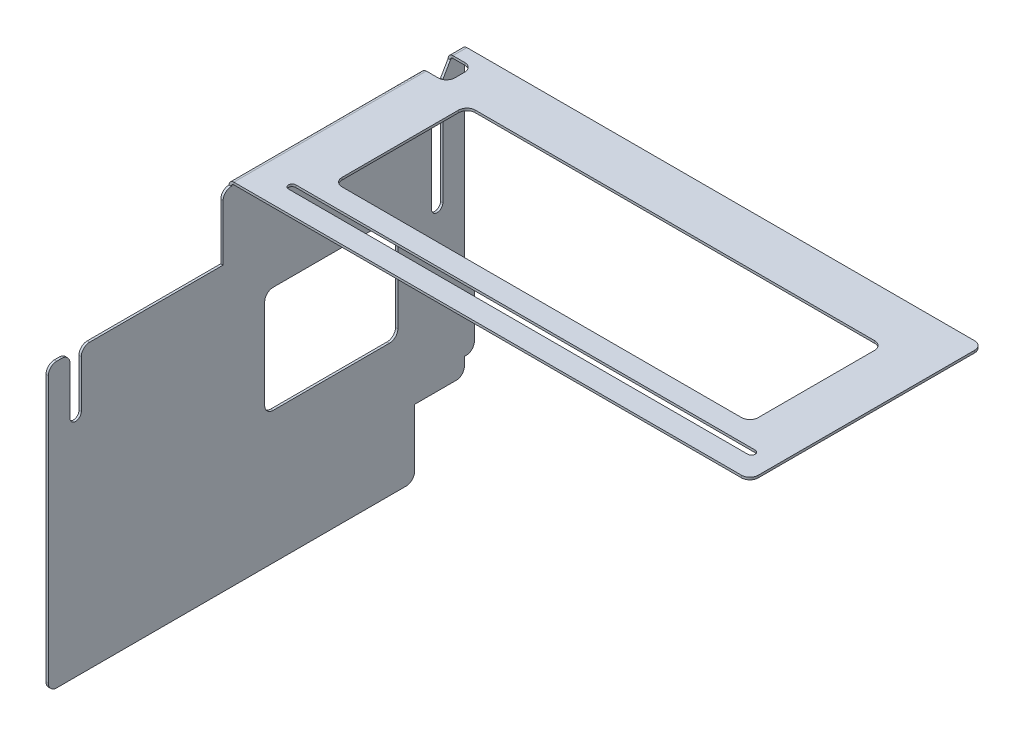
from build123d import *

# Parameters (mm, degrees)
SKETCH1_W               = 125
SKETCH1_H               = 40
BASE_FLANGE1_DEPTH      = 0.7
CUT_EXTRUDE3_DEPTH      = 10
EDGE_FLANGE5_DEPTH      = 70
EDGE_FLANGE5_START      = 0.7
EDGE_FLANGE5_FLAT_DEPTH = 0.7
SKETCH26_W              = 0.7
SKETCH26_H              = 85
BOSS_EXTRUDE1_DEPTH     = 55
SKETCH27_W              = 0.7
SKETCH27_H              = 20
BOSS_EXTRUDE2_DEPTH     = 3
CUT_EXTRUDE4_START      = -63.5
CUT_EXTRUDE4_DEPTH      = 3.4
CUT_EXTRUDE4_START_2    = -1.4366
CUT_EXTRUDE4_2_DEPTH    = 0.7
SKETCH30_W              = 2.5
SKETCH30_H              = 19.2634
TAB1_DEPTH              = 0.7
BREAK_CORNER1_START     = -2
BREAK_CORNER1_DEPTH     = 2
BREAK_CORNER1_2_DEPTH   = 3
CUT_EXTRUDE5_DEPTH      = 7.5
SKETCH32_W              = 40
SKETCH32_H              = 32
CUT_EXTRUDE6_DEPTH      = 0.7
FILLET1_R               = 2.5


with BuildPart() as part:
    # Base-Flange1: sheet metal written as solids
    # Sketch1 → Base-Flange1 (new body)
    with BuildSketch(Plane(origin=(0, 0, 0), x_dir=(1, 0, 0), z_dir=(0, 1, 0))):
        Polygon((0, 0), (155, 0), (155, 70), (0, 70), (0, 55), (0, 15), align=None)
        with Locations((77.5, 35)):
            Rectangle(SKETCH1_W, SKETCH1_H, mode=Mode.SUBTRACT)
    extrude(amount=-BASE_FLANGE1_DEPTH)

    # Sketch22 → Cut-Extrude3 (cut)
    with BuildSketch(Plane(origin=(0, 0, 0), x_dir=(1, 0, 0), z_dir=(0, 1, 0))):
        with BuildLine():
            Line((10, 8.6), (148, 8.6))
            ThreePointArc((148, 8.6), (149.1, 7.5), (148, 6.4))
            Line((148, 6.4), (10, 6.4))
            ThreePointArc((10, 6.4), (8.9, 7.5), (10, 8.6))
        make_face()
    extrude(amount=-CUT_EXTRUDE3_DEPTH, mode=Mode.SUBTRACT)

    # Edge-Flange5: sheet metal written as solids
    # Edge-Flange5 bend section (on a plane across the edge) → Edge-Flange5 (add)
    with BuildSketch(Plane(origin=(-0.7366, -0.7, 0), x_dir=(1, 0, 0), z_dir=(0, 0, -1))):
        with BuildLine():
            Line((-0.7, 0.7366), (0, 0.7366))
            ThreePointArc((0, 0.7366), (0.215745145, 0.215745145), (0.7366, 0))
            Line((0.7366, 0), (0.7366, -0.7))
            ThreePointArc((0.7366, -0.7), (-0.279229602, -0.279229602), (-0.7, 0.7366))
        make_face()
    extrude(amount=EDGE_FLANGE5_DEPTH)

    # Edge-Flange5 profile (on flange) → Edge-Flange5 flat (add)
    with BuildSketch(Plane(origin=(-0.7366, -0.7, 0), x_dir=(0, 0, -1), z_dir=(-1, 0, 0)).offset(EDGE_FLANGE5_START)):
        Polygon((70, 0.7366), (70, 85), (55, 85), (55, 105), (0, 105), (0, 0.7366), align=None)
    extrude(amount=-EDGE_FLANGE5_FLAT_DEPTH)

    # Sketch26 → Boss-Extrude1 (add)
    with BuildSketch(Plane.XY):
        with Locations((-1.0866, -63.2)):
            Rectangle(SKETCH26_W, SKETCH26_H)
    extrude(amount=BOSS_EXTRUDE1_DEPTH)

    # Sketch27 → Boss-Extrude2 (add)
    with BuildSketch(Plane(origin=(0, 0, -70), x_dir=(-1, 0, 0), z_dir=(0, 0, -1))):
        with Locations((1.0866, -70.7)):
            Rectangle(SKETCH27_W, SKETCH27_H)
    extrude(amount=BOSS_EXTRUDE2_DEPTH)

    # Cut-Extrude4: read off the stored shape, not the designer's step
    # Cut-Extrude4 outline → Cut-Extrude4 (cut)
    with BuildSketch(Plane.XY.offset(CUT_EXTRUDE4_START)):
        with BuildLine():
            ThreePointArc((-0.7366, -1.4366), (-0.640617257, -1.073021825), (-0.377683113, -0.804195836))
            Line((-0.377683113, -0.804195836), (-0.7366, -0.203214415))
            ThreePointArc((-0.7366, -0.203214415), (-1.249403682, -0.727509033), (-1.4366, -1.4366))
            Line((-1.4366, -1.4366), (-1.4366, -20.7))
            Line((-1.4366, -20.7), (-0.7366, -20.7))
            Line((-0.7366, -20.7), (-0.7366, -1.4366))
        make_face()
    extrude(amount=CUT_EXTRUDE4_DEPTH, mode=Mode.SUBTRACT)

    # Cut-Extrude4 2 outline → Cut-Extrude4 2 (cut)
    with BuildSketch(Plane.YZ.offset(CUT_EXTRUDE4_START_2)):
        with BuildLine():
            Line((-20.7, -60.1), (-37.5, -60.1))
            ThreePointArc((-37.5, -60.1), (-39.2, -61.8), (-37.5, -63.5))
            Line((-37.5, -63.5), (-20.7, -63.5))
            Line((-20.7, -63.5), (-20.7, -60.1))
        make_face()
        with BuildLine():
            Line((-20.7, 48.5), (-37.5, 48.5))
            ThreePointArc((-37.5, 48.5), (-39.2, 46.8), (-37.5, 45.1))
            Line((-37.5, 45.1), (-20.7, 45.1))
            Line((-20.7, 45.1), (-20.7, 48.5))
        make_face()
    extrude(amount=CUT_EXTRUDE4_2_DEPTH, mode=Mode.SUBTRACT)

    # Tab1: sheet metal written as solids
    # Sketch30 → Tab1 (add)
    with BuildSketch(Plane.ZY.offset(1.4366)):
        with Locations((1.25, -11.0683)):
            Rectangle(SKETCH30_W, SKETCH30_H)
    extrude(amount=-TAB1_DEPTH)

    # Break-Corner1: read off the stored shape, not the designer's step
    # Break-Corner1 outline → Break-Corner1 (cut)
    with BuildSketch(Plane.YZ.offset(BREAK_CORNER1_START)):
        with BuildLine():
            Line((-105.7, 55), (-105.7, 52.5))
            ThreePointArc((-105.7, 52.5), (-104.967766953, 54.267766953), (-103.2, 55))
            Line((-103.2, 55), (-105.7, 55))
        make_face()
        with BuildLine():
            ThreePointArc((-60.7, -70.5), (-61.432233047, -72.267766953), (-63.2, -73))
            Line((-63.2, -73), (-60.7, -73))
            Line((-60.7, -73), (-60.7, -70.5))
        make_face()
        with BuildLine():
            ThreePointArc((-78.2, -73), (-79.967766953, -72.267766953), (-80.7, -70.5))
            Line((-80.7, -70.5), (-80.7, -73))
            Line((-80.7, -73), (-78.2, -73))
        make_face()
        with BuildLine():
            ThreePointArc((-83.2, -70), (-84.967766953, -69.267766953), (-85.7, -67.5))
            Line((-85.7, -67.5), (-85.7, -70))
            Line((-85.7, -70), (-83.2, -70))
        make_face()
        with BuildLine():
            ThreePointArc((-103.2, -55), (-104.967766953, -54.267766953), (-105.7, -52.5))
            Line((-105.7, -52.5), (-105.7, -55))
            Line((-105.7, -55), (-103.2, -55))
        make_face()
        with BuildLine():
            Line((-20.7, 48.5), (-20.7, 51))
            ThreePointArc((-20.7, 51), (-21.432233047, 49.232233047), (-23.2, 48.5))
            Line((-23.2, 48.5), (-20.7, 48.5))
        make_face()
        with BuildLine():
            Line((-20.7, 55), (-23.2, 55))
            ThreePointArc((-23.2, 55), (-21.432233047, 54.267766953), (-20.7, 52.5))
            Line((-20.7, 52.5), (-20.7, 55))
        make_face()
        with BuildLine():
            Line((-20.7, 45.1), (-23.2, 45.1))
            ThreePointArc((-23.2, 45.1), (-21.432233047, 44.367766953), (-20.7, 42.6))
            Line((-20.7, 42.6), (-20.7, 45.1))
        make_face()
        with BuildLine():
            Line((-1.4366, 2.5), (-3.9366, 2.5))
            ThreePointArc((-3.9366, 2.5), (-2.168833047, 1.767766953), (-1.4366, 0))
            Line((-1.4366, 0), (-1.4366, 2.5))
        make_face()
    extrude(amount=BREAK_CORNER1_DEPTH, mode=Mode.SUBTRACT)

    # Break-Corner1 2 outline → Break-Corner1 2 (cut)
    with BuildSketch(Plane(origin=(0, 0, 0), x_dir=(1, 0, 0), z_dir=(0, 1, 0)).offset(BREAK_CORNER1_START)):
        with BuildLine():
            Line((155, 0), (155, 2.5))
            ThreePointArc((155, 2.5), (154.267766953, 0.732233047), (152.5, 0))
            Line((152.5, 0), (155, 0))
        make_face()
        with BuildLine():
            ThreePointArc((152.5, 70), (154.267766953, 69.267766953), (155, 67.5))
            Line((155, 67.5), (155, 70))
            Line((155, 70), (152.5, 70))
        make_face()
    extrude(amount=BREAK_CORNER1_2_DEPTH, mode=Mode.SUBTRACT)

    # Sketch31 → Cut-Extrude5 (cut)
    with BuildSketch(Plane.ZY.offset(1.4366)):
        Polygon((-60.1, -5.420316857), (-63.5, -5.420316857), (-65.8, -1.4366), (-65.8, 0), (-57.8, 0), (-57.8, -1.4366), align=None)
    extrude(amount=-CUT_EXTRUDE5_DEPTH, mode=Mode.SUBTRACT)

    # Sketch32 → Cut-Extrude6 (cut)
    with BuildSketch(Plane.ZY.offset(1.4366)):
        with Locations((-30, -50)):
            Rectangle(SKETCH32_W, SKETCH32_H)
    extrude(amount=-CUT_EXTRUDE6_DEPTH, mode=Mode.SUBTRACT)

    # Fillet1
    fillet1_edges = [part.edges().sort_by_distance(p)[0] for p in [
        (15, -0.35, -55),
        (140, -0.35, -55),
        (140, -0.35, -15),
        (15, -0.35, -15),
        (6.0634, -0.35, -57.8),
        (6.0634, -0.35, -65.8),
        (-1.0866, -34, -10),
        (-1.0866, -66, -10),
        (-1.0866, -66, -50),
        (-1.0866, -34, -50),
    ]]
    fillet(fillet1_edges, radius=FILLET1_R)


solid = part.part
